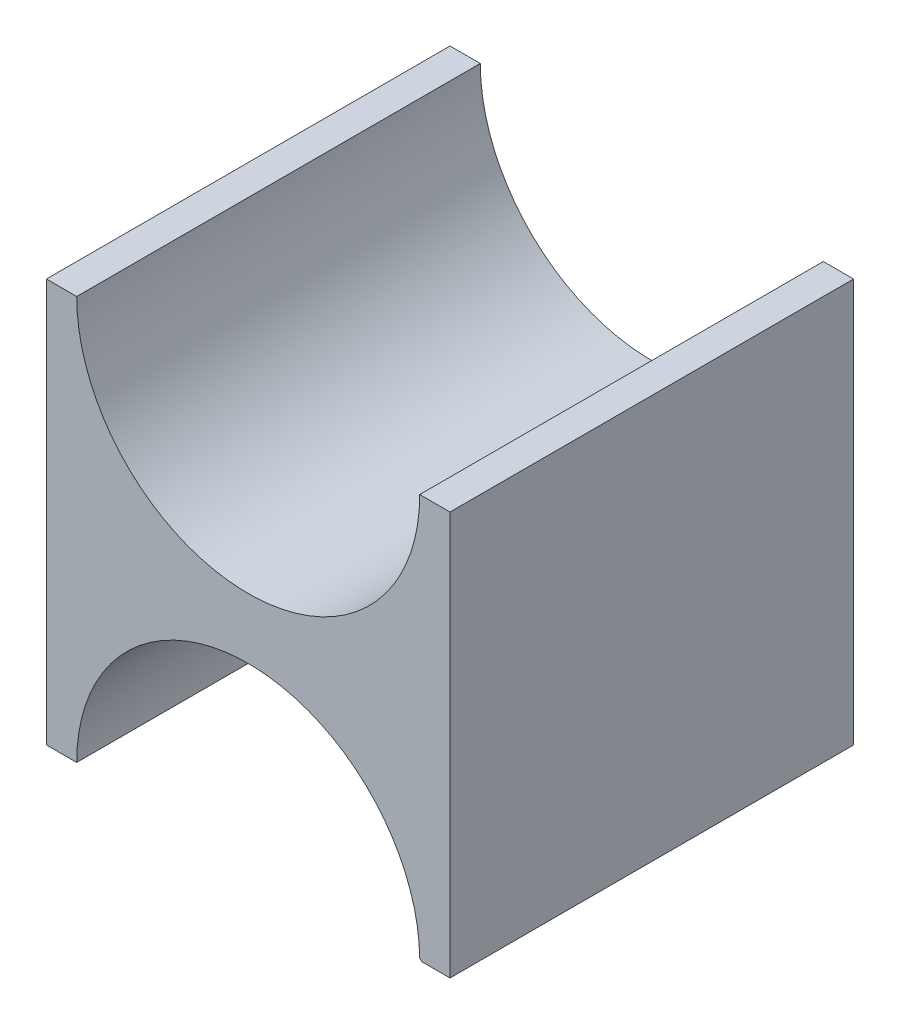
from build123d import *

# Parameters (mm, degrees)
BOSS_EXTRUDE1_DEPTH = 20
CUT_EXTRUDE1_DEPTH  = 25.494897428


with BuildPart() as part:
    # Sketch1 → Boss-Extrude1 (new body)
    with BuildSketch(Plane.XY):
        with BuildLine():
            Line((-10, -10), (-8.5, -10))
            ThreePointArc((-8.5, -10), (0, -1.5), (8.5, -10))
            Line((8.5, -10), (10, -10))
            Line((10, -10), (10, 10))
            Line((10, 10), (8.5, 10))
            ThreePointArc((8.5, 10), (0, 1.5), (-8.5, 10))
            Line((-8.5, 10), (-10, 10))
            Line((-10, 10), (-10, -10))
        make_face()
    extrude(amount=BOSS_EXTRUDE1_DEPTH)

    # Sketch2 → Cut-Extrude1 (cut, through all)
    with BuildSketch(Plane.XY.offset(20)):
        Polygon((8.5, -10), (8.604574766, -10), (8.493585424, -9.889010658), align=None)
    extrude(amount=-CUT_EXTRUDE1_DEPTH, mode=Mode.SUBTRACT)


solid = part.part
